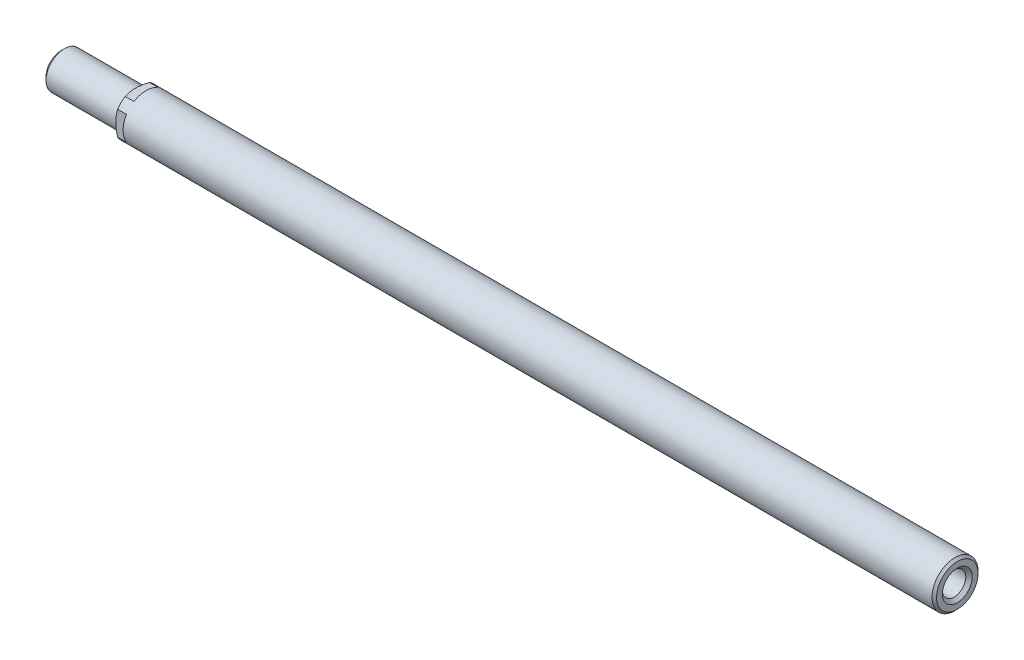
from build123d import *

# Parameters (mm, degrees)
SZKIC1_R                          = 10
DODANIE_WYCI_GNI_CIE1_DEPTH       = 357.5
SZKIC2_R                          = 8
DODANIE_WYCI_GNI_CIE2_DEPTH       = 32
SFAZOWANIE1_SIZE                  = 1.5
SFAZOWANIE2_SIZE2                 = 1.154700538
SFAZOWANIE2_SIZE                  = 2
SZKIC3_W                          = 28.491583868
SZKIC3_H                          = 26.39290166
SZKIC3_W_2                        = 17
SZKIC3_H_2                        = 17
WYTNIJ_WYCI_GNI_CIE1_DEPTH        = 5
SFAZOWANIE3_SIZE                  = 1
OTW_R_GWINTOWANY_M121_D           = 10.2
OTW_R_GWINTOWANY_M121_DEPTH       = 18
OTW_R_GWINTOWANY_M121_CSINK_D     = 13
OTW_R_GWINTOWANY_M121_CSINK_ANGLE = 90
OTW_R_GWINTOWANY_M121_TIP         = 3.064389157


with BuildPart() as part:
    # Szkic1 → Dodanie-wyciągnięcie1 (new body)
    with BuildSketch(Plane(origin=(0, 0, 0), x_dir=(0, 0, -1), z_dir=(1, 0, 0))):
        with Locations((-94.635912223, 0)):
            Circle(SZKIC1_R)
    extrude(amount=-DODANIE_WYCI_GNI_CIE1_DEPTH)

    # Szkic2 → Dodanie-wyciągnięcie2 (add)
    with BuildSketch(Plane.ZY.offset(357.5)):
        with Locations((94.635912223, 0)):
            Circle(SZKIC2_R)
    extrude(amount=DODANIE_WYCI_GNI_CIE2_DEPTH)

    # Sfazowanie1
    sfazowanie1_edges = [part.edges().sort_by_distance(p)[0] for p in [
        (-389.5, 0, 86.635912223),
    ]]
    chamfer(sfazowanie1_edges, length=SFAZOWANIE1_SIZE)

    # Sfazowanie2
    sfazowanie2_edges = [part.edges().sort_by_distance(p)[0] for p in [
        (-357.5, 0, 104.635912223),
    ]]
    sfazowanie2_side = [part.faces().sort_by_distance(p)[0] for p in [
        (-357.5, 0, 104.612818213),
    ]]
    chamfer(sfazowanie2_edges, length=SFAZOWANIE2_SIZE - 0.0001, length2=SFAZOWANIE2_SIZE2 - 0.0001, reference=sfazowanie2_side[0])  # a hair under: the kernel refuses the full size

    # Szkic3 → Wytnij-wyciągnięcie1 (cut)
    with BuildSketch(Plane.ZY.offset(357.5)):
        with Locations((94.635912223, 0)):
            Rectangle(SZKIC3_W, SZKIC3_H)
        with Locations((94.635912223, 0)):
            Rectangle(SZKIC3_W_2, SZKIC3_H_2, mode=Mode.SUBTRACT)
    extrude(amount=-WYTNIJ_WYCI_GNI_CIE1_DEPTH, mode=Mode.SUBTRACT)

    # Sfazowanie3
    sfazowanie3_edges = [part.edges().sort_by_distance(p)[0] for p in [
        (0, 0, 104.635912223),
    ]]
    chamfer(sfazowanie3_edges, length=SFAZOWANIE3_SIZE)

    # Otwór gwintowany M121
    with Locations(Plane(origin=(0, 0, 0), x_dir=(0, 0, -1), z_dir=(1, 0, 0))):
        with Locations((-94.635912223, 0)):
            CounterSinkHole(OTW_R_GWINTOWANY_M121_D / 2, OTW_R_GWINTOWANY_M121_CSINK_D / 2, depth=OTW_R_GWINTOWANY_M121_DEPTH, counter_sink_angle=OTW_R_GWINTOWANY_M121_CSINK_ANGLE)
            with Locations((0, 0, -(OTW_R_GWINTOWANY_M121_DEPTH + OTW_R_GWINTOWANY_M121_TIP / 2))):  # 118° drill point
                Cone(0, OTW_R_GWINTOWANY_M121_D / 2, OTW_R_GWINTOWANY_M121_TIP, mode=Mode.SUBTRACT)


solid = part.part
